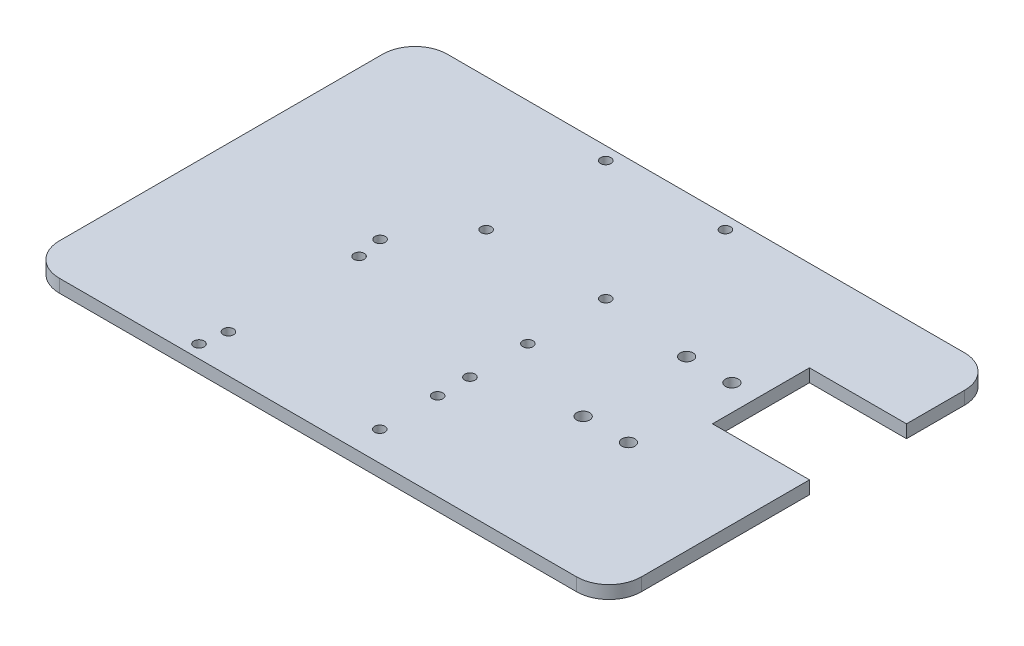
from build123d import *

# Parameters (mm, degrees)
SKETCH_1_W          = 180
SKETCH_1_H          = 120
EXTRUDE_1_DEPTH     = 4
SKETCH_3_W          = 40
SKETCH_3_H          = 30
CUT_EXTRUDE_2_DEPTH = 4
SKETCH_4_R          = 1.6
CUT_EXTRUDE_3_DEPTH = 4
SKETCH_5_R          = 1.6
CUT_EXTRUDE_4_DEPTH = 4
SKETCH_7_R          = 2
CUT_EXTRUDE_5_DEPTH = 10
FILLET_1_R          = 10


with BuildPart() as part:
    # 草图1 → 凸台-拉伸1 (new body)
    with BuildSketch(Plane(origin=(0, 0, 0), x_dir=(1, 0, 0), z_dir=(0, 1, 0))):
        Rectangle(SKETCH_1_W, SKETCH_1_H)
    extrude(amount=EXTRUDE_1_DEPTH)

    # 草图3 → 切除-拉伸2 (cut)
    with BuildSketch(Plane(origin=(0, 4, 0), x_dir=(1, 0, 0), z_dir=(0, 1, 0))):
        with Locations((80, 17)):
            Rectangle(SKETCH_3_W, SKETCH_3_H)
    extrude(amount=-CUT_EXTRUDE_2_DEPTH, mode=Mode.SUBTRACT)

    # 草图4 → 切除-拉伸3 (cut)
    with BuildSketch(Plane(origin=(0, 4, 0), x_dir=(1, 0, 0), z_dir=(0, 1, 0))):
        with Locations((-27, 56)):
            Circle(SKETCH_4_R)
        with Locations((10, 56)):
            Circle(SKETCH_4_R)
        with Locations((10, 19)):
            Circle(SKETCH_4_R)
        with Locations((-27, 19)):
            Circle(SKETCH_4_R)
    extrude(amount=-CUT_EXTRUDE_3_DEPTH, mode=Mode.SUBTRACT)

    # 草图5 → 切除-拉伸4 (cut)
    with BuildSketch(Plane(origin=(0, 4, 0), x_dir=(1, 0, 0), z_dir=(0, 1, 0))):
        with Locations((-39.5, -7.8)):
            Circle(SKETCH_5_R)
        with Locations((10, -23)):
            Circle(SKETCH_5_R)
        with Locations((10, -50.9)):
            Circle(SKETCH_5_R)
        with Locations((-40.8, -56)):
            Circle(SKETCH_5_R)
        with Locations((10, -5.1)):
            Circle(SKETCH_5_R)
        with Locations((10, -33)):
            Circle(SKETCH_5_R)
        with Locations((-40.8, 0)):
            Circle(SKETCH_5_R)
        with Locations((-39.5, -48.2)):
            Circle(SKETCH_5_R)
    extrude(amount=-CUT_EXTRUDE_4_DEPTH, mode=Mode.SUBTRACT)

    # 草图7 → 切除-拉伸5 (cut)
    with BuildSketch(Plane.XZ):
        with Locations((52, 16)):
            Circle(SKETCH_7_R)
        with Locations((38, 16)):
            Circle(SKETCH_7_R)
        with Locations((52, -16)):
            Circle(SKETCH_7_R)
        with Locations((38, -16)):
            Circle(SKETCH_7_R)
    extrude(amount=-CUT_EXTRUDE_5_DEPTH, mode=Mode.SUBTRACT)

    # 圆角1
    fillet_1_edges = [part.edges().sort_by_distance(p)[0] for p in [
        (90, 2, 60),
        (90, 2, -60),
        (-90, 2, -60),
        (-90, 2, 60),
    ]]
    fillet(fillet_1_edges, radius=FILLET_1_R)


solid = part.part
